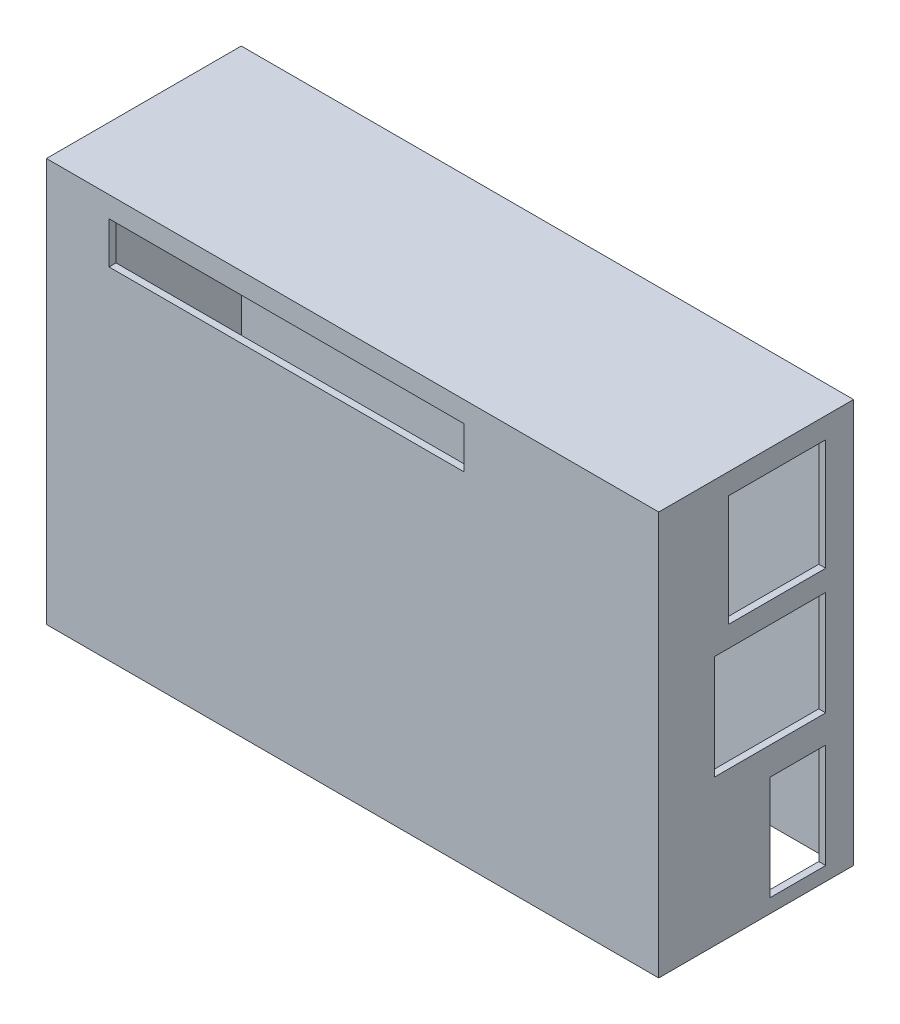
from build123d import *

# Parameters (mm, degrees)
SKETCH_1_W          = 88
SKETCH_1_H          = 58
EXTRUDE_1_DEPTH     = 28
SKETCH_2_W          = 26
SKETCH_2_H          = 56
CUT_EXTRUDE_1_DEPTH = 87
SKETCH_3_W          = 8
SKETCH_3_H          = 15
SKETCH_3_W_2        = 16
SKETCH_3_W_3        = 14
SKETCH_3_H_2        = 16
CUT_EXTRUDE_2_DEPTH = 87
SKETCH_4_W          = 28
SKETCH_4_H          = 58
EXTRUDE_2_DEPTH     = 1
SKETCH_6_W          = 51
SKETCH_6_H          = 6
CUT_EXTRUDE_4_DEPTH = 10
SKETCH_7_W          = 5
SKETCH_7_H          = 9
CUT_EXTRUDE_5_DEPTH = 10
SKETCH_8_W          = 86
SKETCH_8_H          = 26
CUT_EXTRUDE_6_DEPTH = 57


with BuildPart() as part:
    # 草图1 → 凸台-拉伸1 (new body)
    with BuildSketch(Plane.XY):
        with Locations((5.73433584, -4.901711192)):
            Rectangle(SKETCH_1_W, SKETCH_1_H)
    extrude(amount=EXTRUDE_1_DEPTH)

    # 草图2 → 切除-拉伸1 (cut)
    with BuildSketch(Plane.ZY.offset(38.26566416)):
        with Locations((14, -4.901711192)):
            Rectangle(SKETCH_2_W, SKETCH_2_H)
    extrude(amount=-CUT_EXTRUDE_1_DEPTH, mode=Mode.SUBTRACT)

    # 草图3 → 切除-拉伸2 (cut)
    with BuildSketch(Plane(origin=(49.73433584, 0, 0), x_dir=(0, 0, -1), z_dir=(1, 0, 0))):
        with Locations((-8, -24.401711192)):
            Rectangle(SKETCH_3_W, SKETCH_3_H)
        with Locations((-12, -5.401711192)):
            Rectangle(SKETCH_3_W_2, SKETCH_3_H)
        with Locations((-11, 13.098288808)):
            Rectangle(SKETCH_3_W_3, SKETCH_3_H_2)
    extrude(amount=-CUT_EXTRUDE_2_DEPTH, mode=Mode.SUBTRACT)

    # 草图4 → 凸台-拉伸2 (add)
    with BuildSketch(Plane.ZY.offset(38.26566416)):
        with Locations((14, -4.901711192)):
            Rectangle(SKETCH_4_W, SKETCH_4_H)
    extrude(amount=-EXTRUDE_2_DEPTH)

    # 草图6 → 切除-拉伸4 (cut)
    with BuildSketch(Plane.XY.offset(28)):
        with Locations((-3.76566416, 18.098288808)):
            Rectangle(SKETCH_6_W, SKETCH_6_H)
    extrude(amount=-CUT_EXTRUDE_4_DEPTH, mode=Mode.SUBTRACT)

    # 草图7 → 切除-拉伸5 (cut)
    with BuildSketch(Plane.ZY.offset(38.26566416)):
        with Locations((5.5, 12.598288808)):
            Rectangle(SKETCH_7_W, SKETCH_7_H)
    extrude(amount=-CUT_EXTRUDE_5_DEPTH, mode=Mode.SUBTRACT)

    # 草图8 → 切除-拉伸6 (cut)
    with BuildSketch(Plane.XZ.offset(33.901711192)):
        with Locations((5.73433584, 14)):
            Rectangle(SKETCH_8_W, SKETCH_8_H)
    extrude(amount=-CUT_EXTRUDE_6_DEPTH, mode=Mode.SUBTRACT)


solid = part.part
